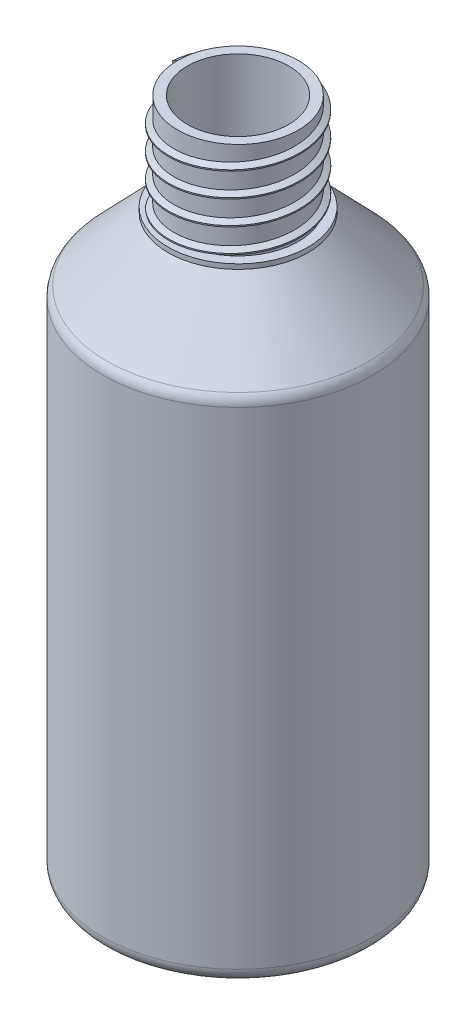
from build123d import *

# Parameters (mm, degrees)
RADYUS1_R  = 3
DI_1_PITCH = 5


# Read off the part's stored shape, not the designer's step: İç Boşaltma1
with BuildPart() as part:
    # Çizim1 → Döndür1 (revolve)
    with BuildSketch(Plane.XY, mode=Mode.PRIVATE) as d_nd_r1_sk:
        Polygon((0, 0), (-28, 0), (-28, 105), (-14.5, 119), (-14.5, 120), (-12.5, 120), (-12.5, 140), (0, 140), align=None)
    revolve(d_nd_r1_sk.sketch.rotate(Axis((0, 0, 0), (0, 1, 0)), 270), axis=Axis((0, 0, 0), (0, 1, 0)))

    # Radyus1
    radyus1_edges = [part.edges().sort_by_distance(p)[0] for p in [
        (0, 105, 28),
        (0, 0, 28),
    ]]
    fillet(radyus1_edges, radius=RADYUS1_R)

    # İç Boşaltma1 outline → İç Boşaltma1 (revolve, cut)
    with BuildSketch(Plane.XY):
        with BuildLine():
            Line((0, 140), (0, 2))
            Line((0, 2), (25, 2))
            ThreePointArc((25, 2), (25.707106781, 2.292893219), (26, 3))
            Line((26, 3), (26, 103.789188814))
            ThreePointArc((26, 103.789188814), (25.927319873, 104.163458572), (25.719844295, 104.483324384))
            Line((25.719844295, 104.483324384), (12.685907094, 118))
            Line((12.685907094, 118), (10.5, 118))
            Line((10.5, 118), (10.5, 140))
            Line((10.5, 140), (0, 140))
        make_face()
    revolve(axis=Axis((0, 0, 0), (0, 1, 0)), mode=Mode.SUBTRACT)

    # Diş1: the profile of Diş Profili1 profile screwed along a right-hand helix of 4 turns, 12 arcs to a turn; built about Z, then put on its axis
    di_1_z = Axis((0, 0, 0), (0, 0, 1))
    di_1_corners = [(12.4997, 0, -0.000173205), (13.58253175, 0, 0.624999997), (13.58253175, 0, 0.874999997), (12.4997, 0, 1.5001732)]
    with BuildLine(mode=Mode.PRIVATE) as di_1_profile:
        Line(di_1_corners[0], di_1_corners[1])
        Line(di_1_corners[1], di_1_corners[2])
        Line(di_1_corners[2], di_1_corners[3])
        Line(di_1_corners[3], di_1_corners[0])
    di_1_cap = Face(di_1_profile.wire())
    di_1_turn_angles = [0, 15, 30, 45, 60, 75, 90, 105, 120, 135, 150, 165, 180, 195, 210, 225, 240, 255, 270, 285, 300, 315, 330, 345, 360]
    di_1_turn_weights = [1, 0.9659258262890683, 1, 0.9659258262890683, 1, 0.9659258262890683, 1, 0.9659258262890683, 1, 0.9659258262890683, 1, 0.9659258262890683, 1, 0.9659258262890683, 1, 0.9659258262890683, 1, 0.9659258262890683, 1, 0.9659258262890683, 1, 0.9659258262890683, 1, 0.9659258262890683, 1]
    di_1_turn_rails = [Edge.make_bspline([Vector(p[0], p[1], 0).rotate(di_1_z, di_1_turn_angles[k]) / di_1_turn_weights[k] + Vector(0, 0, p[2] + DI_1_PITCH * di_1_turn_angles[k] / 360) for k in range(25)], [0, 0, 0, 1, 1, 2, 2, 3, 3, 4, 4, 5, 5, 6, 6, 7, 7, 8, 8, 9, 9, 10, 10, 11, 11, 12, 12, 12], 2, di_1_turn_weights) for p in di_1_corners]
    di_1_turn_sides = [Face.make_surface_from_curves(di_1_turn_rails[p[0]], di_1_turn_rails[p[1]]) for p in [(0, 1), (1, 2), (2, 3), (3, 0)]]
    di_1 = Plane(origin=(0, 140, 0), x_dir=(-1, 0, 0), z_dir=(0, -1, 0)) * Solid(Shell([*[p.moved(Location((0, 0, DI_1_PITCH * i))) for i in range(4) for p in di_1_turn_sides], di_1_cap, di_1_cap.rotate(di_1_z, 1440).moved(Location((0, 0, DI_1_PITCH * 1440 / 360)))]))
    add(di_1)


solid = part.part
